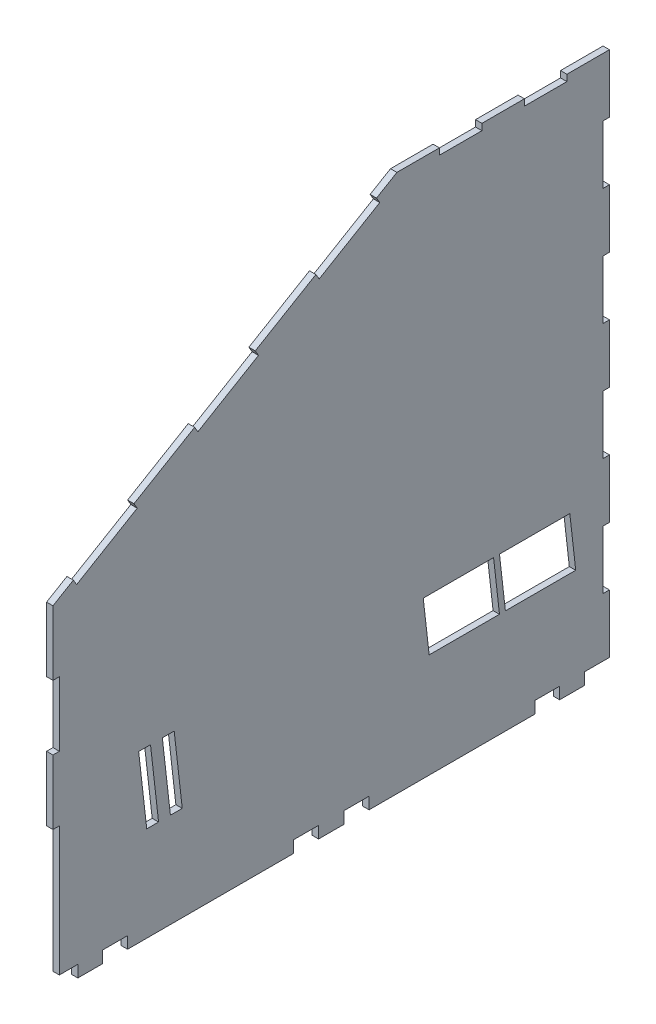
from build123d import *

# Parameters (mm, degrees)
BOSS_EXTRUDE1_DEPTH = 2.7


with BuildPart() as part:
    # Sketch1 → Boss-Extrude1 (new body)
    with BuildSketch(Plane(origin=(0, 0, 0), x_dir=(0, 0, -1), z_dir=(1, 0, 0))):
        Polygon((117.52, 87.8), (117.52, 112.5), (99.566, 112.5), (99.566, 109.8), (81.612, 109.8), (81.612, 112.5), (63.658, 112.5), (63.658, 109.8), (45.704, 109.8), (45.704, 112.5), (27.75, 112.5), (19.142256818, 107.410131897), (20.516521206, 105.086041238), (-5.094381521, 89.941988479), (-6.468645909, 92.266079138), (-32.079548636, 77.122026379), (-30.705284249, 74.79793572), (-56.316186976, 59.653882961), (-57.690451364, 61.977973621), (-83.301354091, 46.833920862), (-81.927089703, 44.509830203), (-107.53799243, 29.365777444), (-108.912256818, 31.689868103), (-117.52, 26.6), (-117.52, -0.68), (-114.82, -0.68), (-114.82, -27.96), (-117.52, -27.96), (-117.52, -55.24), (-114.82, -55.24), (-114.82, -82.52), (-114.82, -109.8), (-107.013333333, -109.8), (-107.013333333, -112.5), (-107.013333333, -114.8), (-96.506666667, -114.8), (-96.506666667, -112.5), (-96.506666667, -109.8), (-86, -109.8), (-86, -112.5), (-86, -114.8), (-16, -114.8), (-16, -112.5), (-16, -109.8), (-5.333333333, -109.8), (-5.333333333, -112.5), (-5.333333333, -114.8), (5.333333333, -114.8), (5.333333333, -112.5), (5.333333333, -109.8), (16, -109.8), (16, -112.5), (16, -114.8), (86, -114.8), (86, -112.5), (86, -109.8), (96.506666667, -109.8), (96.506666667, -112.5), (96.506666667, -114.8), (107.013333333, -114.8), (107.013333333, -112.5), (107.013333333, -109.8), (117.52, -109.8), (117.52, -85.1), (114.82, -85.1), (114.82, -60.4), (117.52, -60.4), (117.52, -35.7), (114.82, -35.7), (114.82, -11), (117.52, -11), (117.52, 13.7), (114.82, 13.7), (114.82, 38.4), (117.52, 38.4), (117.52, 63.1), (114.82, 63.1), (114.82, 87.8), align=None)
        Polygon((-72.910909091, -74.8), (-77.910909091, -74.8), (-81.32, -44.8), (-76.32, -44.8), align=None, mode=Mode.SUBTRACT)
        Polygon((-66.32, -44.8), (-62.910909091, -74.8), (-67.910909091, -74.8), (-71.32, -44.8), align=None, mode=Mode.SUBTRACT)
        Polygon((41.38, -48.8), (68.58, -48.8), (71.08, -70.8), (41.38, -70.8), (38.88, -48.8), align=None, mode=Mode.SUBTRACT)
        Polygon((71.08, -48.8), (100.78, -48.8), (103.28, -70.8), (100.78, -70.8), (73.58, -70.8), align=None, mode=Mode.SUBTRACT)
    extrude(amount=BOSS_EXTRUDE1_DEPTH)


solid = part.part
